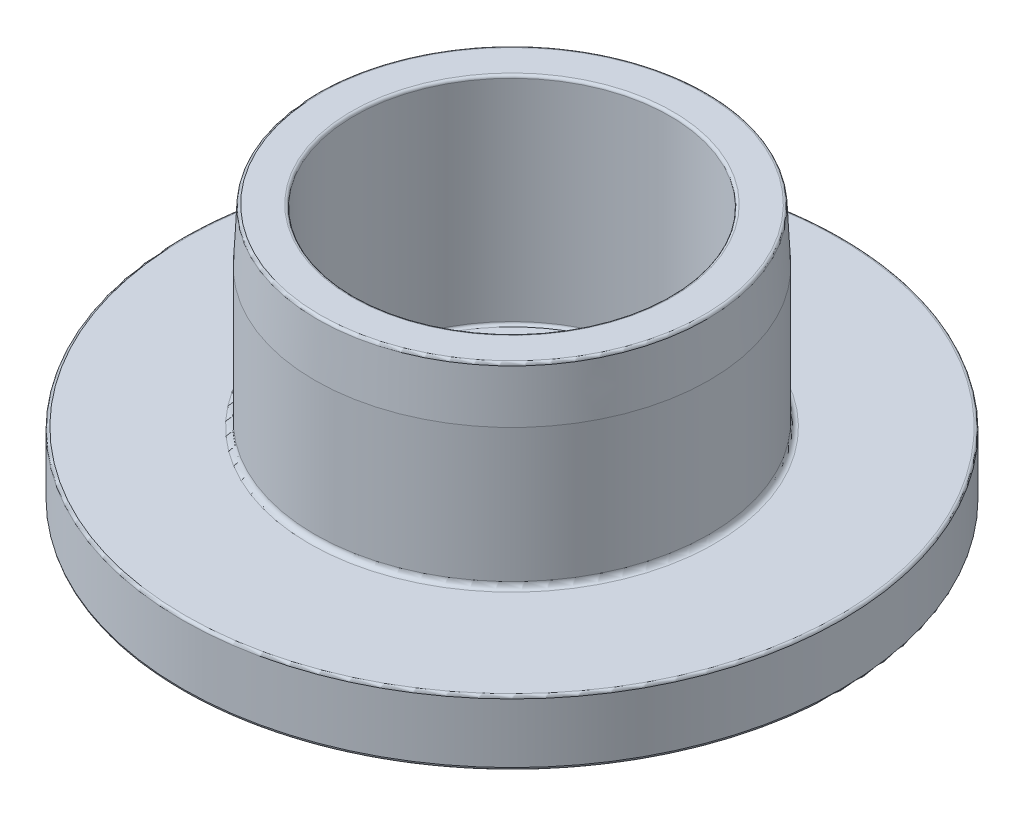
from build123d import *

# Parameters (mm, degrees)
FILETE1_R      = 0.5
FILETE2_R      = 1
CHANFRO1_SIZE  = 1
CHANFRO1_SIZE2 = 0.577350269
FILETE3_R      = 0.5
FILETE4_R      = 1.5
FILETE5_R      = 0.5
FILETE6_R      = 1


with BuildPart() as part:
    # Esboço1 → Revolução1 (revolve)
    with BuildSketch(Plane.XY, mode=Mode.PRIVATE) as revolu_o1_sk:
        Polygon((29.25, 49.922822823), (36, 49.922822823), (36.5, 39.922822823), (36.5, 14.222822823), (61, 14.222822823), (61, 2.222822823), (33, 2.222822823), (33, -5.277177177), (32, -5.277177177), (30.75, -17.777177177), (23.5, -17.777177177), (23.5, 9.922822823), (29.25, 9.922822823), align=None)
    revolve(revolu_o1_sk.sketch.rotate(Axis((0, -52.516216216, 0), (0, 1, 0)), 90), axis=Axis((0, -52.516216216, 0), (0, 1, 0)))

    # Filete1
    filete1_edges = [part.edges().sort_by_distance(p)[0] for p in [
        (0, 2.222822823, 61),
        (0, 14.222822823, 61),
        (0, 49.922822823, 36),
        (0, 49.922822823, 29.25),
    ]]
    fillet(filete1_edges, radius=FILETE1_R)

    # Filete2
    filete2_edges = [part.edges().sort_by_distance(p)[0] for p in [
        (0, 14.222822823, 36.5),
    ]]
    fillet(filete2_edges, radius=FILETE2_R)

    # Chanfro1
    chanfro1_edges = [part.edges().sort_by_distance(p)[0] for p in [
        (0, 9.922822823, 23.5),
    ]]
    chanfro1_side = [part.faces().sort_by_distance(p)[0] for p in [
        (0, 9.922822823, 24.327314934),
    ]]
    chamfer(chanfro1_edges, length=CHANFRO1_SIZE, length2=CHANFRO1_SIZE2, reference=chanfro1_side[0])

    # Filete3
    filete3_edges = [part.edges().sort_by_distance(p)[0] for p in [
        (0, 9.922822823, 29.25),
    ]]
    fillet(filete3_edges, radius=FILETE3_R)

    # Filete4
    # the kernel refuses this fillet: 1.5 mm, written as the material it adds along each edge
    with BuildSketch(Plane(origin=(0, -5.277177177, 0), x_dir=(0, 0, -1), z_dir=(1, 0, 0))) as filete4_piece_1:
        with BuildLine():
            CenterArc((33.361912833, -1.455685097), FILETE4_R, 103.961817235, 70.327589628)
            Line((33, 0), (32.992761743, 0.029113702))
            ThreePointArc((32.992761743, 0.029113702), (32.5, 0.03), (32, 0.03))
            Line((32, 0.03), (31.970148884, 0.002985112))
            Line((31.970148884, 0.002985112), (31.839505932, -1.303444407))
            Line((31.839505932, -1.303444407), (31.869357048, -1.306429518))
        make_face()
    revolve(axis=Axis((0, -5.277177177, 0), (0, 1, 0)))

    # Filete5
    filete5_edges = [part.edges().sort_by_distance(p)[0] for p in [
        (0, -17.777177177, 30.75),
        (0, -17.777177177, 23.5),
    ]]
    fillet(filete5_edges, radius=FILETE5_R)

    # Filete6
    filete6_edges = [part.edges().sort_by_distance(p)[0] for p in [
        (0, 2.222822823, 33),
    ]]
    fillet(filete6_edges, radius=FILETE6_R)


solid = part.part
